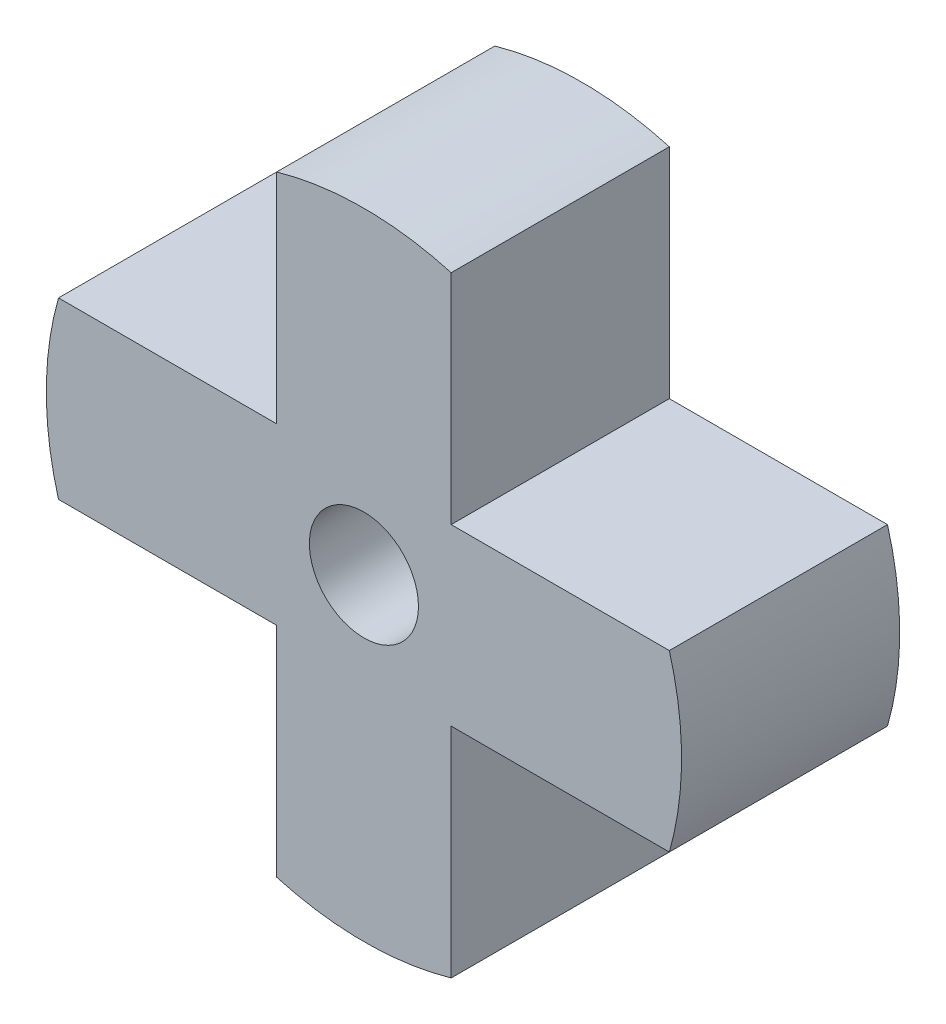
from build123d import *

# Parameters (mm, degrees)
SKETCH1_R           = 1.25
BOSS_EXTRUDE1_DEPTH = 5


with BuildPart() as part:
    # Sketch1 → Boss-Extrude1 (new body)
    with BuildSketch(Plane.XY):
        with BuildLine():
            Line((-2, -2), (-2, -7))
            ThreePointArc((-2, -7), (0, -7.280109889), (2, -7))
            Line((2, -7), (2, -2))
            Line((2, -2), (7, -2))
            ThreePointArc((7, -2), (7.280109889, 0), (7, 2))
            Line((7, 2), (2, 2))
            Line((2, 2), (2, 7))
            ThreePointArc((2, 7), (0, 7.280109889), (-2, 7))
            Line((-2, 7), (-2, 2))
            Line((-2, 2), (-7, 2))
            ThreePointArc((-7, 2), (-7.280109889, 0), (-7, -2))
            Line((-7, -2), (-2, -2))
        make_face()
        Circle(SKETCH1_R, mode=Mode.SUBTRACT)
    extrude(amount=BOSS_EXTRUDE1_DEPTH)


solid = part.part
